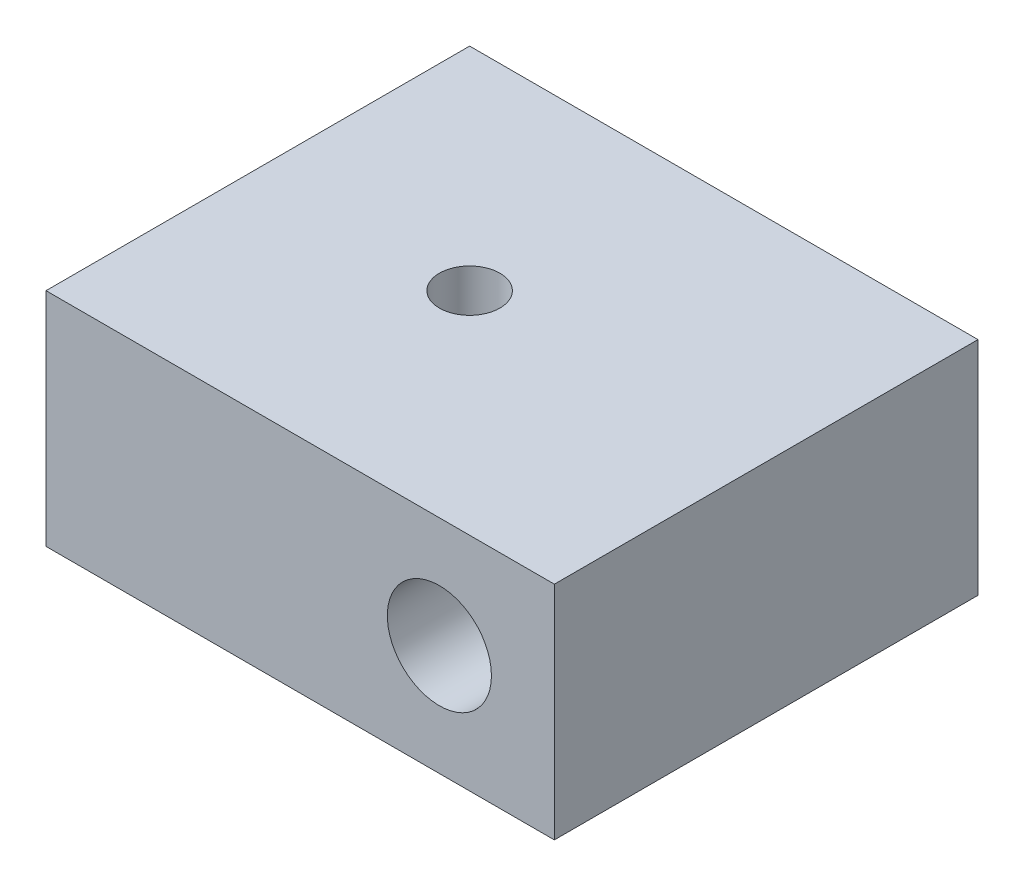
from build123d import *

# Parameters (mm, degrees)
SKETCH1_W           = 42
SKETCH1_H           = 35
SKETCH1_R           = 2.5
BOSS_EXTRUDE1_DEPTH = 18.3
SKETCH2_R           = 4.3
CUT_EXTRUDE1_DEPTH  = 58.653187249


with BuildPart() as part:
    # Sketch1 → Boss-Extrude1 (new body)
    with BuildSketch(Plane(origin=(0, 0, 0), x_dir=(1, 0, 0), z_dir=(0, 1, 0))):
        with Locations((21, 17.5)):
            Rectangle(SKETCH1_W, SKETCH1_H)
        with Locations((17.5, 17.5)):
            Circle(SKETCH1_R, mode=Mode.SUBTRACT)
    extrude(amount=BOSS_EXTRUDE1_DEPTH)

    # Sketch2 → Cut-Extrude1 (cut, through all)
    with BuildSketch(Plane.XY):
        with Locations((32.5, 9.15)):
            Circle(SKETCH2_R)
    extrude(amount=-CUT_EXTRUDE1_DEPTH, mode=Mode.SUBTRACT)


solid = part.part
